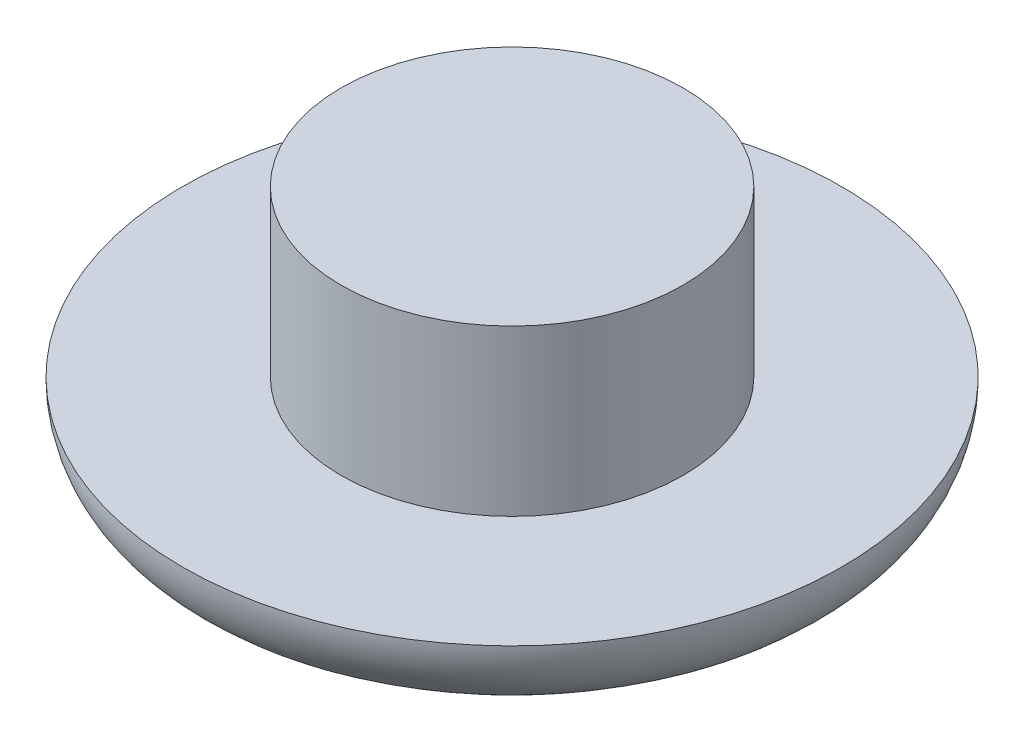
from build123d import *

# Parameters (mm, degrees)
BASE_R              = 40
BOSS_EXTRUDE1_DEPTH = 10
STOPPER_R           = 20.75
BOSS_EXTRUDE2_DEPTH = 20
FILLET1_R           = 10


with BuildPart() as part:
    # base → Boss-Extrude1 (new body)
    with BuildSketch(Plane(origin=(0, 0, 0), x_dir=(1, 0, 0), z_dir=(0, 1, 0))):
        with Locations(Location((0, 0, 0), (0, 0, 270))):
            Circle(BASE_R)
    extrude(amount=-BOSS_EXTRUDE1_DEPTH)

    # stopper → Boss-Extrude2 (add)
    with BuildSketch(Plane(origin=(0, 0, 0), x_dir=(1, 0, 0), z_dir=(0, 1, 0))):
        with Locations(Location((0, 0, 0), (0, 0, 270))):
            Circle(STOPPER_R)
    extrude(amount=BOSS_EXTRUDE2_DEPTH)

    # Fillet1
    fillet1_edges = [part.edges().sort_by_distance(p)[0] for p in [
        (0, -10, -40),
    ]]
    fillet(fillet1_edges, radius=FILLET1_R - 0.0001)  # a hair under: the kernel refuses the full size


solid = part.part
